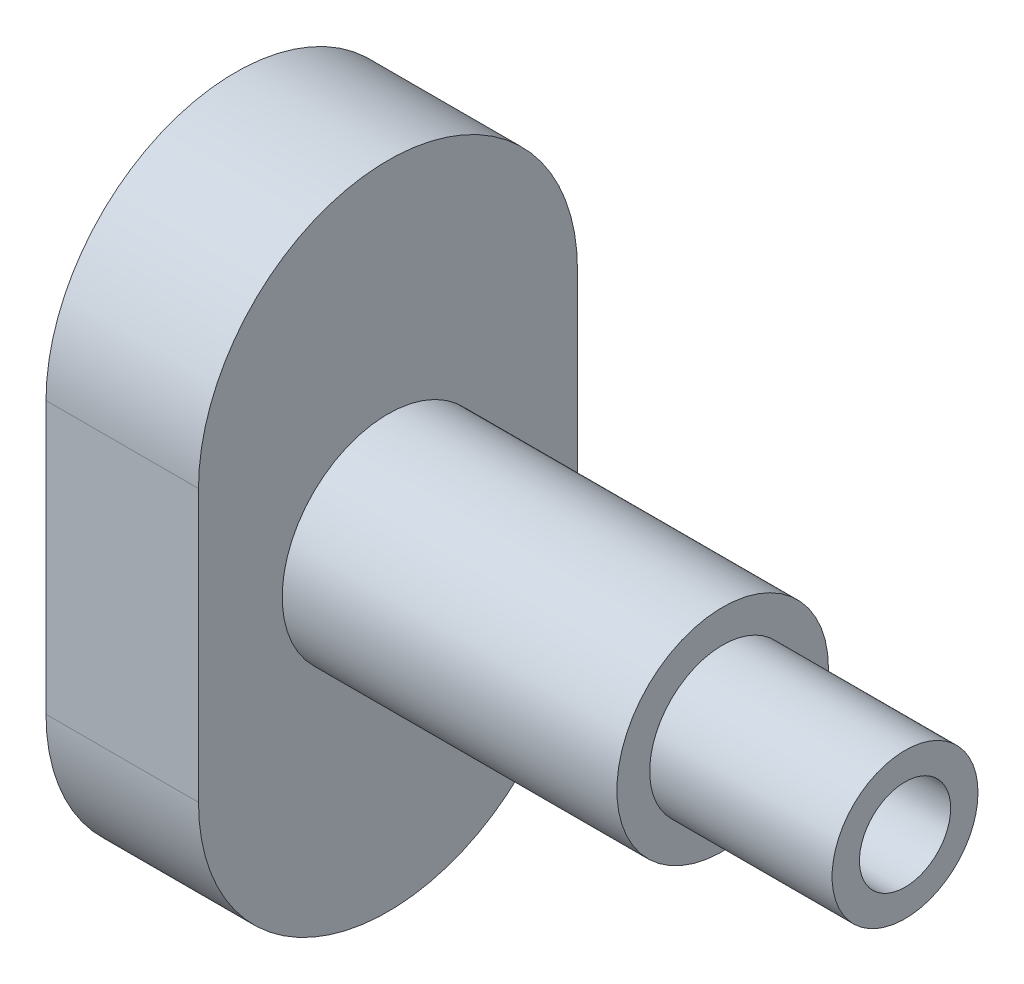
from build123d import *

# Parameters (mm, degrees)
BOSS_EXTRUDE1_DEPTH = 8.36
SKETCH2_R           = 5.8
BOSS_EXTRUDE2_DEPTH = 18.35
SKETCH3_R           = 4
BOSS_EXTRUDE3_DEPTH = 10
SKETCH4_R           = 2.5
CUT_EXTRUDE1_DEPTH  = 43.117001318


with BuildPart() as part:
    # Sketch1 → Boss-Extrude1 (new body)
    with BuildSketch(Plane.YZ):
        with BuildLine():
            Line((-7.45, 10.39), (7.45, 10.39))
            ThreePointArc((7.45, 10.39), (17.84, 0), (7.45, -10.39))
            Line((7.45, -10.39), (-7.45, -10.39))
            ThreePointArc((-7.45, -10.39), (-17.84, 0), (-7.45, 10.39))
        make_face()
    extrude(amount=BOSS_EXTRUDE1_DEPTH)

    # Sketch2 → Boss-Extrude2 (add)
    with BuildSketch(Plane.YZ.offset(8.36)):
        Circle(SKETCH2_R)
    extrude(amount=BOSS_EXTRUDE2_DEPTH)

    # Sketch3 → Boss-Extrude3 (add)
    with BuildSketch(Plane.YZ.offset(26.71)):
        Circle(SKETCH3_R)
    extrude(amount=BOSS_EXTRUDE3_DEPTH)

    # Sketch4 → Cut-Extrude1 (cut, through all)
    with BuildSketch(Plane.YZ.offset(36.71)):
        Circle(SKETCH4_R)
    extrude(amount=-CUT_EXTRUDE1_DEPTH, mode=Mode.SUBTRACT)


solid = part.part
